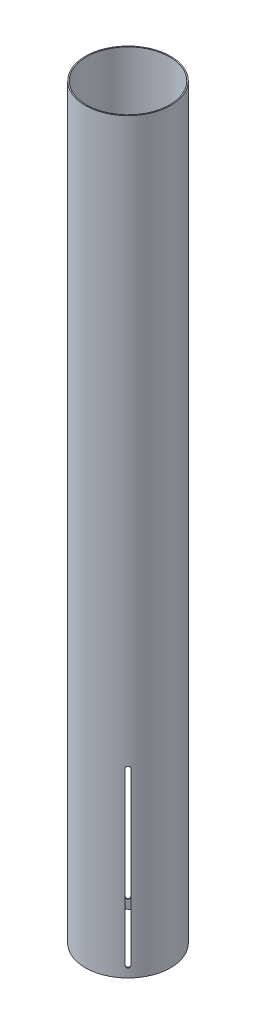
from build123d import *

# Parameters (mm, degrees)
SKETCH1_R           = 50.8
SKETCH1_R_2         = 49.53
BOSS_EXTRUDE1_DEPTH = 889
CUT_EXTRUDE1_DEPTH  = 152.4
CIRPATTERN1_COUNT   = 4


with BuildPart() as part:
    # Sketch1 → Boss-Extrude1 (new body)
    with BuildSketch(Plane(origin=(0, 0, 0), x_dir=(1, 0, 0), z_dir=(0, 1, 0))):
        Circle(SKETCH1_R)
        Circle(SKETCH1_R_2, mode=Mode.SUBTRACT)
    extrude(amount=BOSS_EXTRUDE1_DEPTH)

    # Sketch2 → Cut-Extrude1 (cut)
    with BuildSketch(Plane(origin=(1.021732913, 1243.355570529, -179.1581259), x_dir=(0, 1, 0), z_dir=(0.7071067811865634, 0, -0.7071067811865316))):
        with BuildLine():
            Line((-1230.655570529, 128.342701458), (-1027.455570529, 128.342701458))
            ThreePointArc((-1027.455570529, 128.342701458), (-1025.074320529, 125.961451458), (-1027.455570529, 123.580201458))
            Line((-1027.455570529, 123.580201458), (-1230.655570529, 123.580201458))
            ThreePointArc((-1230.655570529, 123.580201458), (-1233.036820529, 125.961451458), (-1230.655570529, 128.342701458))
        make_face()
    cut_extrude1 = extrude(amount=-CUT_EXTRUDE1_DEPTH, mode=Mode.SUBTRACT)

    # CirPattern1: Cut-Extrude1 ×4 about axis
    cirpattern1_axis = Axis((0, 889, 0), (0, -1, 0))
    for i in range(1, CIRPATTERN1_COUNT):
        add(cut_extrude1.rotate(cirpattern1_axis, i * 360 / CIRPATTERN1_COUNT), mode=Mode.SUBTRACT)


solid = part.part
